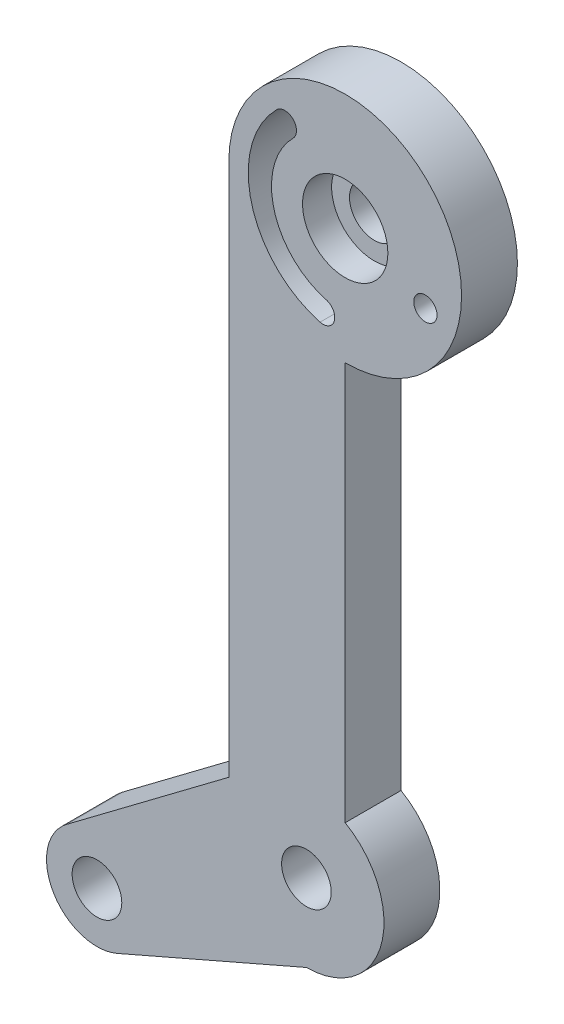
from build123d import *

# Parameters (mm, degrees)
SKETCH1_R           = 1.6
BOSS_EXTRUDE1_DEPTH = 3.6
SKETCH2_R           = 0.75
CUT_EXTRUDE1_DEPTH  = 49.15103841
SKETCH4_R           = 2.75
CUT_EXTRUDE3_DEPTH  = 1.875


with BuildPart() as part:
    # Sketch1 → Boss-Extrude1 (new body)
    with BuildSketch(Plane.XY):
        with BuildLine():
            Line((-5, 37.5), (-5, 3.117408991))
            Line((-5, 3.117408991), (-15.45246273, -4.737424277))
            ThreePointArc((-15.45246273, -4.737424277), (-16.30801025, -8.97190619), (-12.202106424, -10.31516804))
            Line((-12.202106424, -10.31516804), (0, -5))
            ThreePointArc((0, -5), (4.829629131, -1.294095226), (2.5, 4.330127019))
            Line((2.5, 4.330127019), (2.5, 30))
            ThreePointArc((2.5, 30), (7.803300859, 42.803300859), (-5, 37.5))
        make_face()
        Circle(SKETCH1_R, mode=Mode.SUBTRACT)
        with Locations((-13.5, -7.335575406)):
            Circle(SKETCH1_R, mode=Mode.SUBTRACT)
        with Locations((2.5, 37.5)):
            Circle(SKETCH1_R, mode=Mode.SUBTRACT)
    extrude(amount=BOSS_EXTRUDE1_DEPTH)

    # Sketch2 → Cut-Extrude1 (cut, through all)
    with BuildSketch(Plane.XY.offset(3.6)):
        with Locations((7.668309414, 35.618889212)):
            Circle(SKETCH2_R)
        with BuildLine():
            ThreePointArc((-0.858757211, 40.858757211), (-0.858757211, 41.919417382), (-1.919417382, 41.919417382))
            ThreePointArc((-1.919417382, 41.919417382), (-3.537036414, 35.882380968), (0.882380968, 31.462963586))
            ThreePointArc((0.882380968, 31.462963586), (1.800939622, 31.993293672), (1.270609536, 32.911852325))
            ThreePointArc((1.270609536, 32.911852325), (-2.088147675, 36.270609536), (-0.858757211, 40.858757211))
        make_face()
    extrude(amount=-CUT_EXTRUDE1_DEPTH, mode=Mode.SUBTRACT)

    # Sketch4 → Cut-Extrude3 (cut)
    with BuildSketch(Plane.XY.offset(3.6)):
        with Locations((2.5, 37.5)):
            Circle(SKETCH4_R)
    extrude(amount=-CUT_EXTRUDE3_DEPTH, mode=Mode.SUBTRACT)


solid = part.part
